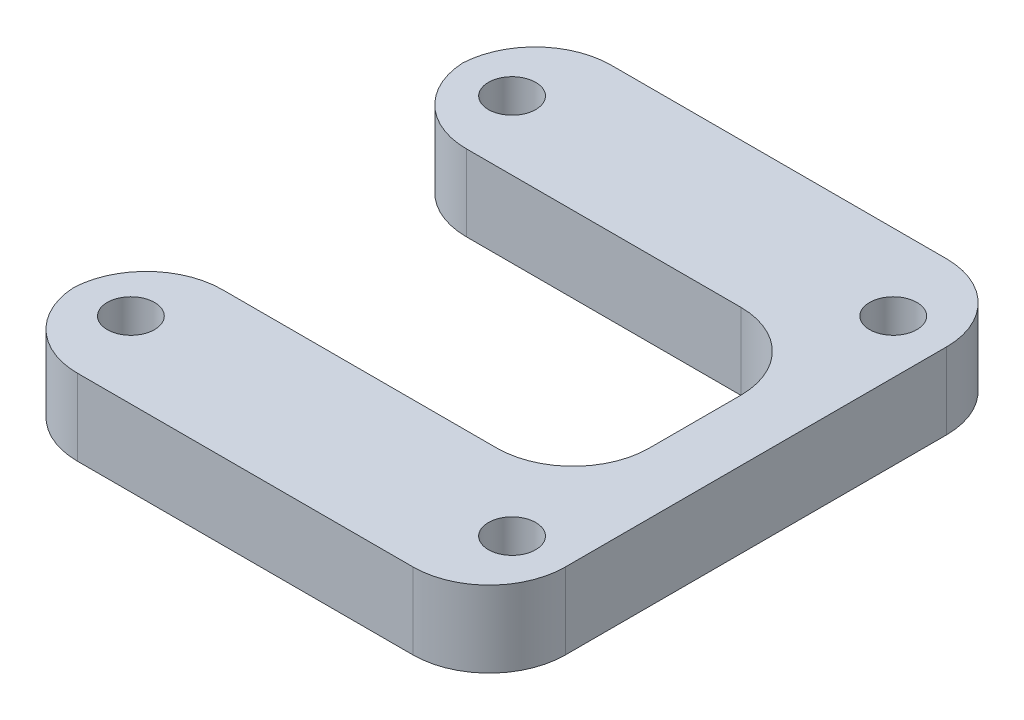
from build123d import *

# Parameters (mm, degrees)
CROQUIS2_R              = 1.55
SALIENTE_EXTRUIR1_DEPTH = 5
REDONDEO9_R             = 5


with BuildPart() as part:
    # Croquis2 → Saliente-Extruir1 (new body)
    with BuildSketch(Plane(origin=(0, 0, 0), x_dir=(1, 0, 0), z_dir=(0, 1, 0))):
        Polygon((16, -17.5), (16, 17.5), (-16, 17.5), (-16, 8), (12, 8), (12, -8), (-16, -8), (-16, -17.5), align=None)
        with Locations(Location((-12.5, -12.5, 0), (0, 0, 270))):
            Circle(CROQUIS2_R, mode=Mode.SUBTRACT)
        with Locations(Location((12.5, -12.5, 0), (0, 0, 270))):
            Circle(CROQUIS2_R, mode=Mode.SUBTRACT)
        with Locations(Location((-12.5, 12.5, 0), (0, 0, 270))):
            Circle(CROQUIS2_R, mode=Mode.SUBTRACT)
        with Locations(Location((12.5, 12.5, 0), (0, 0, 270))):
            Circle(CROQUIS2_R, mode=Mode.SUBTRACT)
    extrude(amount=SALIENTE_EXTRUIR1_DEPTH)

    # Redondeo9
    # the kernel refuses this fillet: 5 mm, written as the material it adds along each edge
    with BuildSketch(Plane(origin=(12, 0, 8), x_dir=(0, 0, -1), z_dir=(0, 1, 0)), Plane(origin=(12, 0, -8), x_dir=(-1, 0, 0), z_dir=(0, 1, 0))) as redondeo9_piece_1:
        with BuildLine():
            CenterArc((REDONDEO9_R, REDONDEO9_R), REDONDEO9_R, 180, 90)
            Line((0, REDONDEO9_R), (0, 0))
            Line((0, 0), (REDONDEO9_R, 0))
        make_face()
    extrude(amount=5)
    # the kernel refuses this fillet: 5 mm, written as the material it takes off along each edge
    with BuildSketch(Plane(origin=(-16, -12.5, 8), x_dir=(0, 0, 1), z_dir=(0, 1, 0))) as redondeo9_2_piece_1:
        with BuildLine():
            CenterArc((REDONDEO9_R, REDONDEO9_R), REDONDEO9_R, 180, 90)
            Line((0, REDONDEO9_R), (0, 0))
            Line((0, 0), (REDONDEO9_R, 0))
        make_face()
    extrude(amount=30, mode=Mode.SUBTRACT)
    with BuildSketch(Plane(origin=(-16, -12.5, 17.5), x_dir=(0, 0, -1), z_dir=(0, 1, 0)), Plane(origin=(-16, -12.5, -17.5), x_dir=(1, 0, 0), z_dir=(0, 1, 0)), Plane(origin=(16, -12.5, -17.5), x_dir=(0, 0, 1), z_dir=(0, 1, 0)), Plane(origin=(-16, -12.5, -8), x_dir=(0, 0, -1), z_dir=(0, 1, 0)), Plane(origin=(16, -12.5, 17.5), x_dir=(-1, 0, 0), z_dir=(0, 1, 0))) as redondeo9_2_piece_2:
        with BuildLine():
            CenterArc((REDONDEO9_R, -REDONDEO9_R), REDONDEO9_R, 90, 90)
            Line((0, -REDONDEO9_R), (0, 0))
            Line((0, 0), (REDONDEO9_R, 0))
        make_face()
    extrude(amount=30, mode=Mode.SUBTRACT)


solid = part.part
